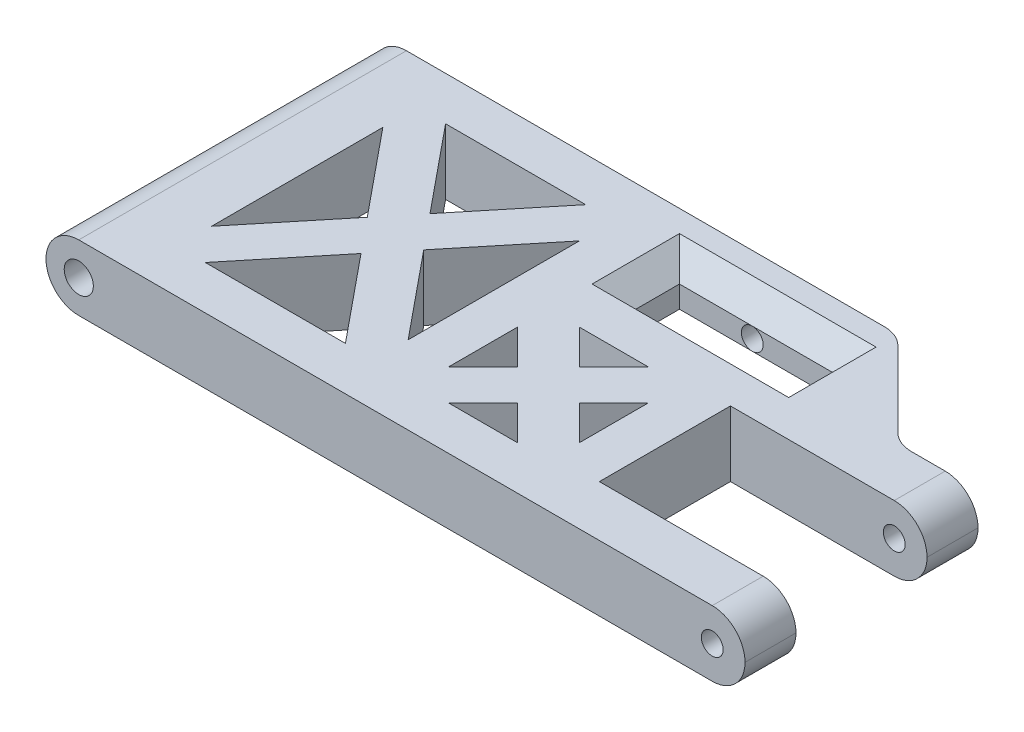
from build123d import *

# Parameters (mm, degrees)
SKETCH1_W                 = 72
SKETCH1_H                 = 45
BOSS_EXTRUDE1_DEPTH       = 9
SKETCH3_W                 = 27
SKETCH3_H                 = 7
BOSS_EXTRUDE3_DEPTH       = 9
SKETCH4_W                 = 27
SKETCH4_H                 = 7
BOSS_EXTRUDE4_DEPTH       = 9
SKETCH5_W                 = 3
SKETCH5_H                 = 18
CUT_EXTRUDE1_DEPTH        = 9
BOSS_EXTRUDE5_DEPTH       = 9
FILLET1_R                 = 4.5
F_4_0MM_DOWEL_HOLE1_D     = 4
F_3_0MM_DOWEL_HOLE1_D     = 3
SKETCH12_W                = 21
SKETCH12_H                = 6
CUT_EXTRUDE3_DEPTH        = 9
CHAMFER1_SIZE             = 3
F_3_0MM_DOWEL_HOLE2_D     = 3
F_3_0MM_DOWEL_HOLE2_DEPTH = 18
F_3_0MM_DOWEL_HOLE2_TIP   = 0.901290929
SKETCH16_W                = 27
SKETCH16_H                = 33
SKETCH16_W_2              = 18
SKETCH16_H_2              = 18
CUT_EXTRUDE4_DEPTH        = 9
BOSS_EXTRUDE7_DEPTH       = 9
BOSS_EXTRUDE8_DEPTH       = 9
BOSS_EXTRUDE10_DEPTH      = 9


with BuildPart() as part:
    # Sketch1 → Boss-Extrude1 (new body)
    with BuildSketch(Plane(origin=(0, 0, 0), x_dir=(1, 0, 0), z_dir=(0, 1, 0))):
        with Locations((36, 22.5)):
            Rectangle(SKETCH1_W, SKETCH1_H)
    extrude(amount=BOSS_EXTRUDE1_DEPTH)

    # Sketch3 → Boss-Extrude3 (add)
    with BuildSketch(Plane(origin=(0, 0, 0), x_dir=(1, 0, 0), z_dir=(0, 1, 0))):
        with Locations((82.5, 28.5)):
            Rectangle(SKETCH3_W, SKETCH3_H)
    extrude(amount=BOSS_EXTRUDE3_DEPTH)

    # Sketch4 → Boss-Extrude4 (add)
    with BuildSketch(Plane(origin=(0, 0, 0), x_dir=(1, 0, 0), z_dir=(0, 1, 0))):
        with Locations((82.5, 3.5)):
            Rectangle(SKETCH4_W, SKETCH4_H)
    extrude(amount=BOSS_EXTRUDE4_DEPTH)

    # Sketch5 → Cut-Extrude1 (cut)
    with BuildSketch(Plane(origin=(0, 9, 0), x_dir=(1, 0, 0), z_dir=(0, 1, 0))):
        with Locations((70.5, 16)):
            Rectangle(SKETCH5_W, SKETCH5_H)
    extrude(amount=-CUT_EXTRUDE1_DEPTH, mode=Mode.SUBTRACT)

    # Sketch6 → Boss-Extrude5 (add)
    with BuildSketch(Plane(origin=(0, 9, 0), x_dir=(1, 0, 0), z_dir=(0, 1, 0))):
        Polygon((72, 45), (72, 32), (85, 32), align=None)
    extrude(amount=-BOSS_EXTRUDE5_DEPTH)

    # Fillet1
    fillet1_edges = [part.edges().sort_by_distance(p)[0] for p in [
        (0, 0, -22.5),
        (0, 9, -22.5),
        (72, 4.5, -45),
        (85, 4.5, -32),
        (96, 0, -3.5),
        (96, 9, -3.5),
        (96, 0, -28.5),
        (96, 9, -28.5),
    ]]
    fillet(fillet1_edges, radius=FILLET1_R - 0.0001)  # a hair under: the kernel refuses the full size

    # Ø4.0mm Dowel Hole1 (through all)
    with Locations(Plane(origin=(0, 0, -45), x_dir=(-1, 0, 0), z_dir=(0, 0, -1))):
        with Locations((-4.5, 4.5)):
            Hole(F_4_0MM_DOWEL_HOLE1_D / 2)

    # Ø3.0mm Dowel Hole1 (through all)
    with Locations(Plane.XY):
        with Locations((91.5, 4.5)):
            Hole(F_3_0MM_DOWEL_HOLE1_D / 2)

    # Sketch12 → Cut-Extrude3 (cut)
    with BuildSketch(Plane(origin=(0, 9, 0), x_dir=(1, 0, 0), z_dir=(0, 1, 0))):
        with Locations((58.5, 36)):
            Rectangle(SKETCH12_W, SKETCH12_H)
    extrude(amount=-CUT_EXTRUDE3_DEPTH, mode=Mode.SUBTRACT)

    # Chamfer1
    chamfer1_edges = [part.edges().sort_by_distance(p)[0] for p in [
        (48, 0, -36),
        (58.5, 0, -39),
        (69, 0, -36),
        (58.5, 0, -33),
        (48, 9, -36),
        (58.5, 9, -33),
        (69, 9, -36),
        (58.5, 9, -39),
    ]]
    chamfer(chamfer1_edges, length=CHAMFER1_SIZE)

    # Ø3.0mm Dowel Hole2
    with Locations(Plane(origin=(0, 0, -45), x_dir=(-1, 0, 0), z_dir=(0, 0, -1))):
        with Locations((-58, 4.5)):
            Hole(F_3_0MM_DOWEL_HOLE2_D / 2, depth=F_3_0MM_DOWEL_HOLE2_DEPTH)
            with Locations((0, 0, -(F_3_0MM_DOWEL_HOLE2_DEPTH + F_3_0MM_DOWEL_HOLE2_TIP / 2))):  # 118° drill point
                Cone(0, F_3_0MM_DOWEL_HOLE2_D / 2, F_3_0MM_DOWEL_HOLE2_TIP, mode=Mode.SUBTRACT)

    # Sketch16 → Cut-Extrude4 (cut)
    with BuildSketch(Plane(origin=(0, 9, 0), x_dir=(1, 0, 0), z_dir=(0, 1, 0))):
        with Locations((25.5, 22.5)):
            Rectangle(SKETCH16_W, SKETCH16_H)
        with Locations((54, 15)):
            Rectangle(SKETCH16_W_2, SKETCH16_H_2)
    extrude(amount=-CUT_EXTRUDE4_DEPTH, mode=Mode.SUBTRACT)

    # Sketch17 → Boss-Extrude7 (add)
    with BuildSketch(Plane(origin=(0, 9, 0), x_dir=(1, 0, 0), z_dir=(0, 1, 0))):
        Polygon((39, 6), (41.321871898, 7.899713371), (14.321871898, 40.899713371), (12, 39), (9.678128102, 37.100286629), (36.678128102, 4.100286629), align=None)
    extrude(amount=-BOSS_EXTRUDE7_DEPTH)

    # Sketch18 → Boss-Extrude8 (add)
    with BuildSketch(Plane(origin=(0, 9, 0), x_dir=(1, 0, 0), z_dir=(0, 1, 0))):
        Polygon((12, 6), (14.321871898, 4.100286629), (41.321871898, 37.100286629), (39, 39), (36.678128102, 40.899713371), (9.678128102, 7.899713371), align=None)
    extrude(amount=-BOSS_EXTRUDE8_DEPTH)

    # Sketch19 → Boss-Extrude10 (add)
    with BuildSketch(Plane(origin=(0, 9, 0), x_dir=(1, 0, 0), z_dir=(0, 1, 0))):
        Polygon((58.242640687, 15), (54, 10.757359313), (58.757359313, 6), (63, 6), (63, 10.242640687), align=None)
        Polygon((45, 19.757359313), (49.757359313, 15), (54, 19.242640687), (49.242640687, 24), (45, 24), align=None)
        Polygon((54, 19.242640687), (58.242640687, 15), (63, 19.757359313), (63, 24), (58.757359313, 24), align=None)
        Polygon((45, 10.242640687), (45, 6), (49.242640687, 6), (54, 10.757359313), (49.757359313, 15), align=None)
        Polygon((49.757359313, 15), (54, 10.757359313), (58.242640687, 15), (54, 19.242640687), align=None)
    extrude(amount=-BOSS_EXTRUDE10_DEPTH)


solid = part.part
